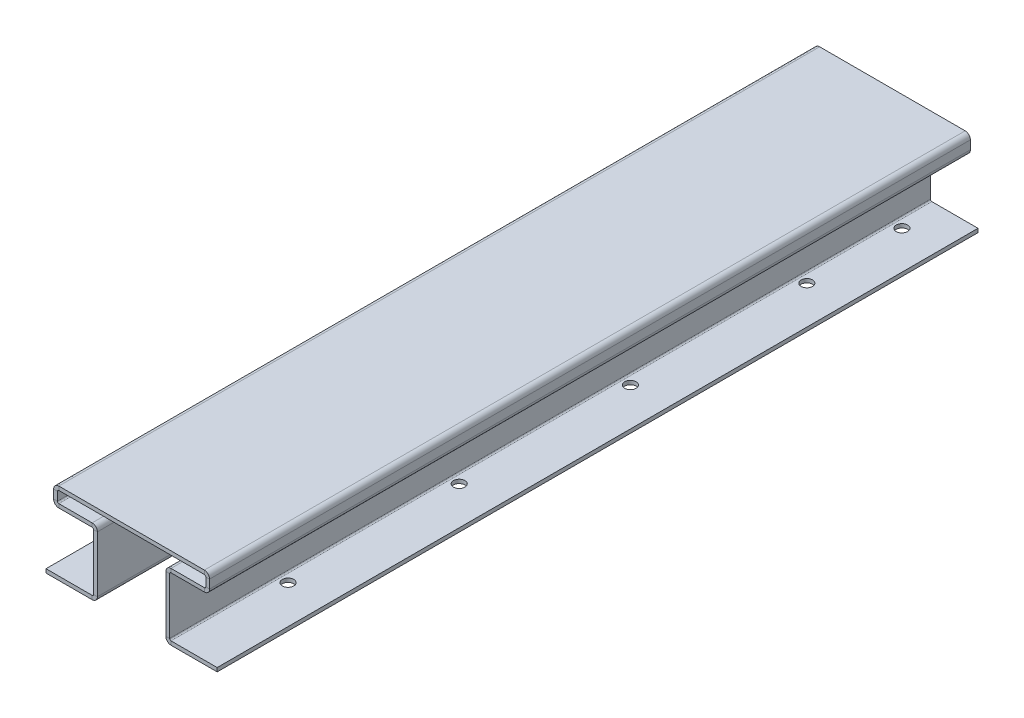
from build123d import *

# Parameters (mm, degrees)
SKETCH1_W                    = 27
SKETCH1_H                    = 400
BASE_FLANGE1_DEPTH           = 2
EDGE_FLANGE1_STRIP_W         = 9.4732
EDGE_FLANGE1_STRIP_H         = 2
EDGE_FLANGE1_STRIP_CUT_DEPTH = 400
EDGE_FLANGE1_DEPTH           = 400
EDGE_FLANGE2_STRIP_W         = 9.4732
EDGE_FLANGE2_STRIP_H         = 2
EDGE_FLANGE2_STRIP_CUT_DEPTH = 400
EDGE_FLANGE2_DEPTH           = 400
EDGE_FLANGE3_STRIP_W         = 9.4732
EDGE_FLANGE3_STRIP_H         = 2
EDGE_FLANGE3_STRIP_CUT_DEPTH = 400
EDGE_FLANGE3_DEPTH           = 400
EDGE_FLANGE4_STRIP_W         = 9.4732
EDGE_FLANGE4_STRIP_H         = 2
EDGE_FLANGE4_STRIP_CUT_DEPTH = 400
EDGE_FLANGE4_DEPTH           = 400
SKETCH18_R                   = 3
CUT_EXTRUDE1_DEPTH           = 219.021214564
SKETCH19_R                   = 3
CUT_EXTRUDE2_DEPTH           = 219.021214564


# Sheet-metal steps are written as plain solids
with BuildPart() as part:
    # Sketch1 → Base-Flange1 (new body)
    with BuildSketch(Plane(origin=(0, 0, 0), x_dir=(1, 0, 0), z_dir=(0, 1, 0))):
        Rectangle(SKETCH1_W, SKETCH1_H)
    extrude(amount=-BASE_FLANGE1_DEPTH)

    # Edge-Flange1 strip (across the edge) → Edge-Flange1 strip cut (cut)
    with BuildSketch(Plane(origin=(13.5, 0, 200), x_dir=(-1, 0, 0), z_dir=(0, 0, -1))):
        with Locations((-2, -1)):
            Rectangle(EDGE_FLANGE1_STRIP_W, EDGE_FLANGE1_STRIP_H)
    extrude(amount=EDGE_FLANGE1_STRIP_CUT_DEPTH, mode=Mode.SUBTRACT)

    # Edge-Flange1 section (across the edge) → Edge-Flange1 (add)
    with BuildSketch(Plane(origin=(13.5, 0, 200), x_dir=(-1, 0, 0), z_dir=(0, 0, -1))):
        with BuildLine():
            Line((0, 0.7366), (0, 33))
            Line((0, 33), (2, 33))
            Line((2, 33), (2, 0.7366))
            ThreePointArc((2, 0.7366), (2.215745145, 0.215745145), (2.7366, 0))
            Line((2.7366, 0), (2.7366, -2))
            ThreePointArc((2.7366, -2), (0.801531583, -1.198468417), (0, 0.7366))
        make_face()
    extrude(amount=EDGE_FLANGE1_DEPTH)

    # Edge-Flange2 strip (across the edge) → Edge-Flange2 strip cut (cut)
    with BuildSketch(Plane(origin=(11.5, 33, 200), x_dir=(0, -1, 0), z_dir=(0, 0, -1))):
        with Locations((-2, -1)):
            Rectangle(EDGE_FLANGE2_STRIP_W, EDGE_FLANGE2_STRIP_H)
    extrude(amount=EDGE_FLANGE2_STRIP_CUT_DEPTH, mode=Mode.SUBTRACT)

    # Edge-Flange2 section (across the edge) → Edge-Flange2 (add)
    with BuildSketch(Plane(origin=(11.5, 33, 200), x_dir=(0, -1, 0), z_dir=(0, 0, -1))):
        with BuildLine():
            Line((0, 0.7366), (0, 21))
            Line((0, 21), (2, 21))
            Line((2, 21), (2, 0.7366))
            ThreePointArc((2, 0.7366), (2.215745145, 0.215745145), (2.7366, 0))
            Line((2.7366, 0), (2.7366, -2))
            ThreePointArc((2.7366, -2), (0.801531583, -1.198468417), (0, 0.7366))
        make_face()
    extrude(amount=EDGE_FLANGE2_DEPTH)

    # Edge-Flange3 strip (across the edge) → Edge-Flange3 strip cut (cut)
    with BuildSketch(Plane(origin=(-9.5, 33, -200), x_dir=(1, 0, 0), z_dir=(0, 0, 1))):
        with Locations((-2, -1)):
            Rectangle(EDGE_FLANGE3_STRIP_W, EDGE_FLANGE3_STRIP_H)
    extrude(amount=EDGE_FLANGE3_STRIP_CUT_DEPTH, mode=Mode.SUBTRACT)

    # Edge-Flange3 section (across the edge) → Edge-Flange3 (add)
    with BuildSketch(Plane(origin=(-9.5, 33, -200), x_dir=(1, 0, 0), z_dir=(0, 0, 1))):
        with BuildLine():
            Line((0, 0.7366), (0, 8))
            Line((0, 8), (2, 8))
            Line((2, 8), (2, 0.7366))
            ThreePointArc((2, 0.7366), (2.215745145, 0.215745145), (2.7366, 0))
            Line((2.7366, 0), (2.7366, -2))
            ThreePointArc((2.7366, -2), (0.801531583, -1.198468417), (0, 0.7366))
        make_face()
    extrude(amount=EDGE_FLANGE3_DEPTH)

    # Edge-Flange4 strip (across the edge) → Edge-Flange4 strip cut (cut)
    with BuildSketch(Plane(origin=(-7.5, 41, -200), x_dir=(0, -1, 0), z_dir=(0, 0, 1))):
        with Locations((-2, -1)):
            Rectangle(EDGE_FLANGE4_STRIP_W, EDGE_FLANGE4_STRIP_H)
    extrude(amount=EDGE_FLANGE4_STRIP_CUT_DEPTH, mode=Mode.SUBTRACT)

    # Edge-Flange4 section (across the edge) → Edge-Flange4 (add)
    with BuildSketch(Plane(origin=(-7.5, 41, -200), x_dir=(0, -1, 0), z_dir=(0, 0, 1))):
        with BuildLine():
            Line((0, 0.7366), (0, 39))
            Line((0, 39), (2, 39))
            Line((2, 39), (2, 0.7366))
            ThreePointArc((2, 0.7366), (2.215745145, 0.215745145), (2.7366, 0))
            Line((2.7366, 0), (2.7366, -2))
            ThreePointArc((2.7366, -2), (0.801531583, -1.198468417), (0, 0.7366))
        make_face()
    extrude(amount=EDGE_FLANGE4_DEPTH)

    # Mirror1: part across plane


with BuildPart() as part_1:
    add(part.part)
    add(part.part.mirror(Plane(origin=(31.5, 41, -200), x_dir=(0, 0, 1), z_dir=(-1, 0, 0))))

    # Sketch18 → Cut-Extrude1 (cut, through all)
    with BuildSketch(Plane(origin=(0, 0, 0), x_dir=(1, 0, 0), z_dir=(0, 1, 0))):
        with Locations(Location((6.5, 180, 0), (0, 0, 270))):
            Circle(SKETCH18_R)
        with Locations(Location((56.5, 130, 0), (0, 0, 270))):
            Circle(SKETCH18_R)
        with Locations(Location((56.5, 180, 0), (0, 0, 270))):
            Circle(SKETCH18_R)
        with Locations(Location((6.5, 130, 0), (0, 0, 270))):
            Circle(SKETCH18_R)
    extrude(amount=-CUT_EXTRUDE1_DEPTH, mode=Mode.SUBTRACT)

    # Sketch19 → Cut-Extrude2 (cut, through all)
    with BuildSketch(Plane(origin=(0, 0, 0), x_dir=(1, 0, 0), z_dir=(0, 1, 0))):
        with Locations(Location((56.5, -142.75, 0), (0, 0, 270))):
            Circle(SKETCH19_R)
        with Locations(Location((56.5, -52.75, 0), (0, 0, 270))):
            Circle(SKETCH19_R)
        with Locations(Location((56.5, 37.25, 0), (0, 0, 270))):
            Circle(SKETCH19_R)
        with Locations(Location((6.5, 37.25, 0), (0, 0, 270))):
            Circle(SKETCH19_R)
        with Locations(Location((6.5, -52.75, 0), (0, 0, 270))):
            Circle(SKETCH19_R)
        with Locations(Location((6.5, -142.75, 0), (0, 0, 270))):
            Circle(SKETCH19_R)
    extrude(amount=-CUT_EXTRUDE2_DEPTH, mode=Mode.SUBTRACT)


solid = part_1.part
